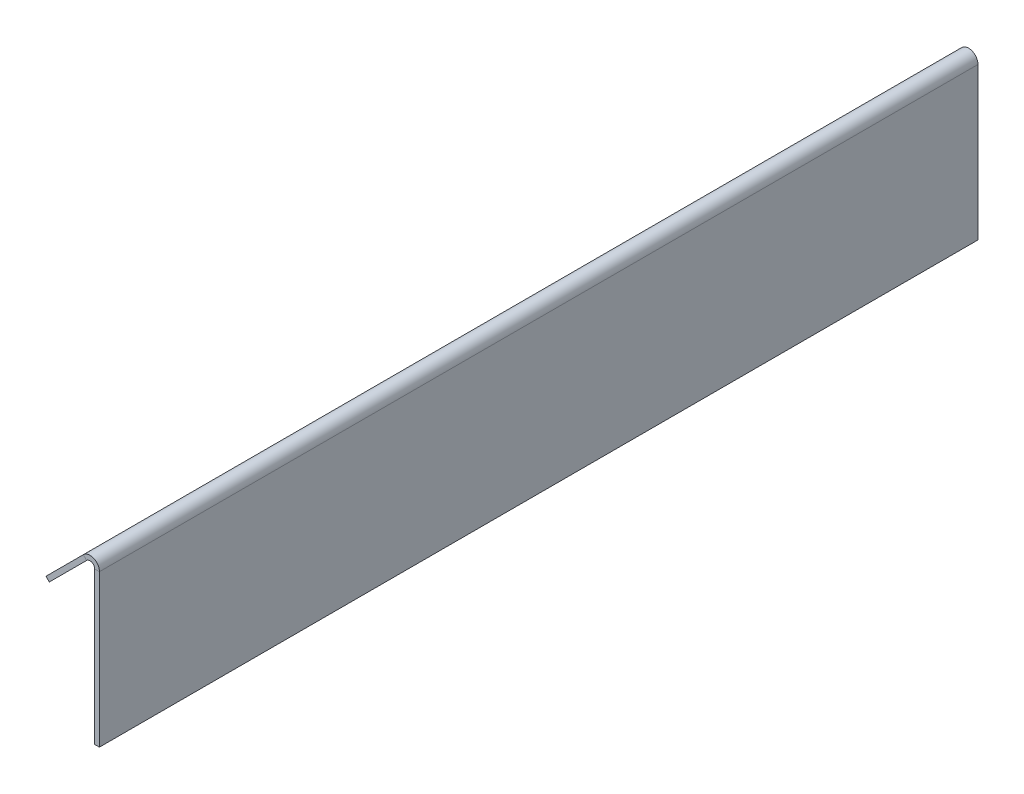
from build123d import *

# Parameters (mm, degrees)
SKETCH1_W            = 590.55
SKETCH1_H            = 114.3
BASE_FLANGE1_DEPTH   = 3.175
EDGE_FLANGE1_START   = -590.55
EDGE_FLANGE1_DEPTH   = 590.55
EDGE_FLANGE1_2_DEPTH = 590.55


# Read off the part's stored shape, not the designer's step: Edge-Flange1
# Sheet-metal steps are written as plain solids
with BuildPart() as part:
    # Sketch1 → Base-Flange1 (new body)
    with BuildSketch(Plane(origin=(0, 0, 0), x_dir=(0, 0, -1), z_dir=(1, 0, 0))):
        with Locations((295.275, 57.15)):
            Rectangle(SKETCH1_W, SKETCH1_H)
    extrude(amount=-BASE_FLANGE1_DEPTH)

    # Edge-Flange1 outline → Edge-Flange1 (cut)
    with BuildSketch(Plane.XY.offset(EDGE_FLANGE1_START)):
        with BuildLine():
            Line((-3.175, 114.3), (-3.175, 107.644005193))
            ThreePointArc((-3.175, 107.644005193), (-0.850738686, 105.319743879), (0, 102.144743879))
            Line((0, 102.144743879), (0, 114.3))
            Line((0, 114.3), (-3.175, 114.3))
        make_face()
    extrude(amount=EDGE_FLANGE1_DEPTH, mode=Mode.SUBTRACT)

    # Edge-Flange1 2 outline → Edge-Flange1 2 (add)
    with BuildSketch(Plane.XY.offset(EDGE_FLANGE1_START)):
        with BuildLine():
            ThreePointArc((-3.175, 107.644005193), (-7.178841321, 108.440418748), (-10.840128061, 106.634871939))
            Line((-10.840128061, 106.634871939), (-35.921024484, 81.553975516))
            Line((-35.921024484, 81.553975516), (-33.675960454, 79.308911485))
            Line((-33.675960454, 79.308911485), (-8.59506403, 104.389807909))
            ThreePointArc((-8.59506403, 104.389807909), (-5.134980102, 105.078061395), (-3.175, 102.144743879))
            Line((-3.175, 102.144743879), (-3.175, 107.644005193))
        make_face()
    extrude(amount=EDGE_FLANGE1_2_DEPTH)


solid = part.part
